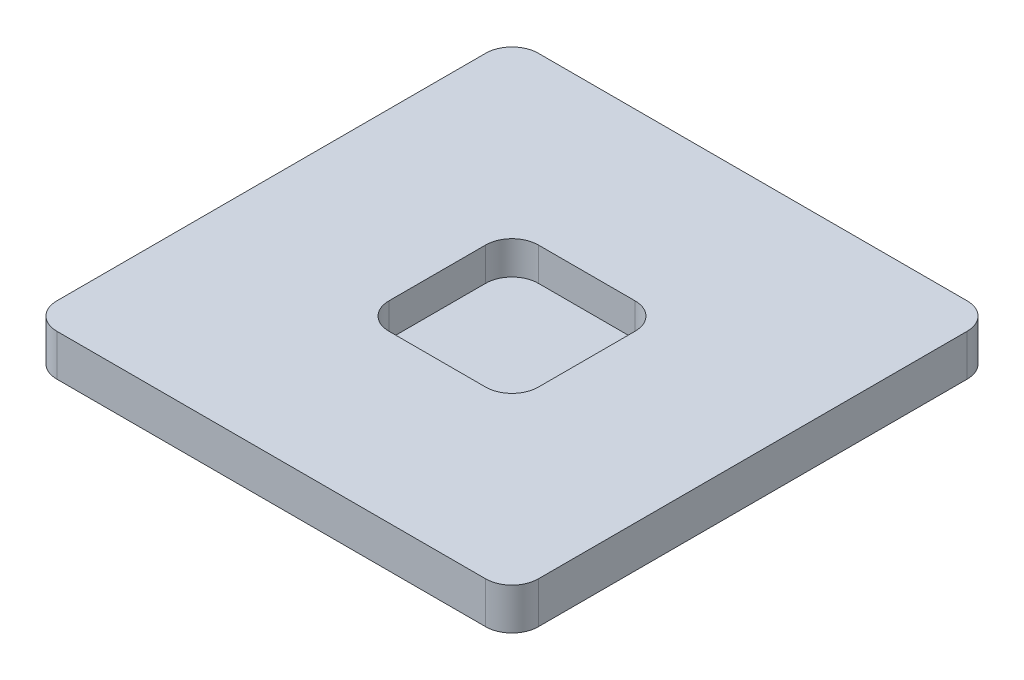
from build123d import *

# Parameters (mm, degrees)
SKETCH1_W           = 29
SKETCH1_H           = 29
BOSS_EXTRUDE1_DEPTH = 7.5
SKETCH8_W           = 9
SKETCH8_H           = 9
CUT_EXTRUDE3_DEPTH  = 2
SKETCH9_W           = 29
SKETCH9_H           = 29
SKETCH9_W_2         = 15
SKETCH9_H_2         = 15
CUT_EXTRUDE4_DEPTH  = 5
CUT_EXTRUDE5_DEPTH  = 2
FILLET1_R           = 1.5875


with BuildPart() as part:
    # Sketch1 → Boss-Extrude1 (new body)
    with BuildSketch(Plane(origin=(0, 0, 0), x_dir=(1, 0, 0), z_dir=(0, 1, 0))):
        with Locations((14.5, 14.5)):
            Rectangle(SKETCH1_W, SKETCH1_H)
    extrude(amount=BOSS_EXTRUDE1_DEPTH)

    # Sketch8 → Cut-Extrude3 (cut)
    with BuildSketch(Plane(origin=(0, 7.5, 0), x_dir=(1, 0, 0), z_dir=(0, 1, 0))):
        with Locations((14.5, 14.5)):
            Rectangle(SKETCH8_W, SKETCH8_H)
    extrude(amount=-CUT_EXTRUDE3_DEPTH, mode=Mode.SUBTRACT)

    # Sketch9 → Cut-Extrude4 (cut)
    with BuildSketch(Plane.XZ):
        with Locations((14.5, -14.5)):
            Rectangle(SKETCH9_W, SKETCH9_H)
        with Locations((14.5, -14.5)):
            Rectangle(SKETCH9_W_2, SKETCH9_H_2, mode=Mode.SUBTRACT)
    extrude(amount=-CUT_EXTRUDE4_DEPTH, mode=Mode.SUBTRACT)

    # Sketch10 → Cut-Extrude5 (cut)
    with BuildSketch(Plane.XZ):
        Polygon((12.75, -7), (16.25, -7), (16.25, -8.825378798), (20.174621202, -12.75), (22, -12.75), (22, -16.25), (20.174621202, -16.25), (16.25, -20.174621202), (16.25, -22), (12.75, -22), (12.75, -20.174621202), (8.825378798, -16.25), (7, -16.25), (7, -12.75), (8.825378798, -12.75), (12.75, -8.825378798), align=None)
    extrude(amount=-CUT_EXTRUDE5_DEPTH, mode=Mode.SUBTRACT)

    # Fillet1
    fillet1_edges = [part.edges().sort_by_distance(p)[0] for p in [
        (16.25, 1, -8.825378798),
        (20.174621202, 1, -12.75),
        (20.174621202, 1, -16.25),
        (16.25, 1, -20.174621202),
        (12.75, 1, -20.174621202),
        (8.825378798, 1, -16.25),
        (8.825378798, 1, -12.75),
        (12.75, 1, -8.825378798),
        (0, 6.25, 0),
        (29, 6.25, 0),
        (29, 6.25, -29),
        (0, 6.25, -29),
        (10, 6.5, -10),
        (19, 6.5, -10),
        (19, 6.5, -19),
        (10, 6.5, -19),
    ]]
    fillet(fillet1_edges, radius=FILLET1_R)


solid = part.part
